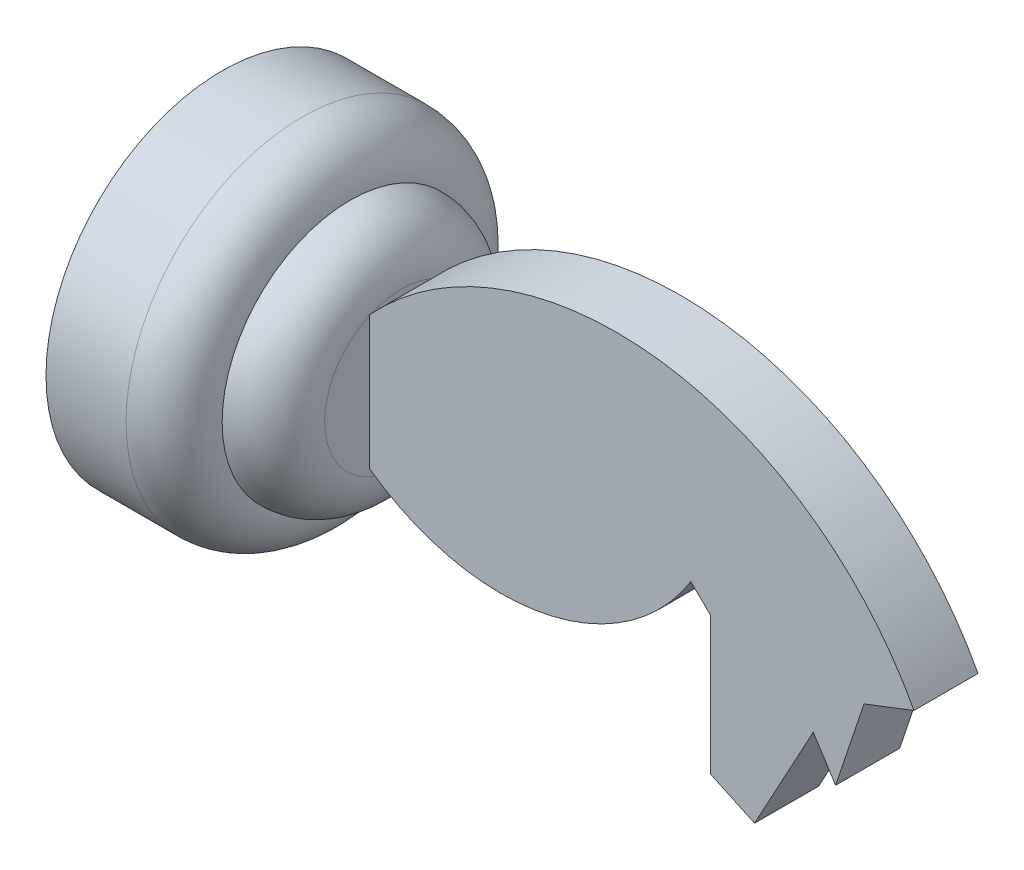
from build123d import *

# Parameters (mm, degrees)
EXTRUDE_1985_DEPTH = 2


with BuildPart() as part:
    # Sketch 227 → Повернуть1 (revolve)
    with BuildSketch(Plane.XY):
        with BuildLine():
            Line((0, 11), (0, 0))
            Line((0, 0), (1, 0))
            Line((1, 0), (1, 5.25))
            Line((1, 5.25), (3.5, 5.25))
            Line((3.5, 5.25), (3.5, 0))
            Line((3.5, 0), (11.2, 0))
            Line((11.2, 0), (11.2, 4.8))
            ThreePointArc((11.2, 4.8), (10.2627417, 7.0627417), (8, 8))
            ThreePointArc((8, 8), (7.121320344, 10.121320344), (5, 11))
            Line((5, 11), (0, 11))
        make_face()
    revolve(axis=Axis((0, 0, 0), (1, 0, 0)))

    # Sketch 967 → Extrude 1985 (add, symmetric)
    with BuildSketch(Plane.XY):
        with BuildLine():
            Line((11.2, 4.4), (11.2, -3.914978255))
            ThreePointArc((11.2, -3.914978255), (22.080678837, -6.30816882), (31.263463773, 0))
            Line((31.263463773, 0), (32.498964702, -1.197255299))
            Line((32.498964702, -1.197255299), (32.498964702, -9.797255299))
            Line((32.498964702, -9.797255299), (35.248695767, -11.07))
            Line((35.248695767, -11.07), (38.912013935, -4.32))
            Line((38.912013935, -4.32), (40.307542508, -6.49))
            Line((40.307542508, -6.49), (42.083014277, -1.2))
            Line((42.083014277, -1.2), (45.2, 0))
            ThreePointArc((45.2, 0), (29.338267199, 10.995701086), (11.2, 4.4))
        make_face()
    extrude(amount=EXTRUDE_1985_DEPTH, both=True)


solid = part.part
